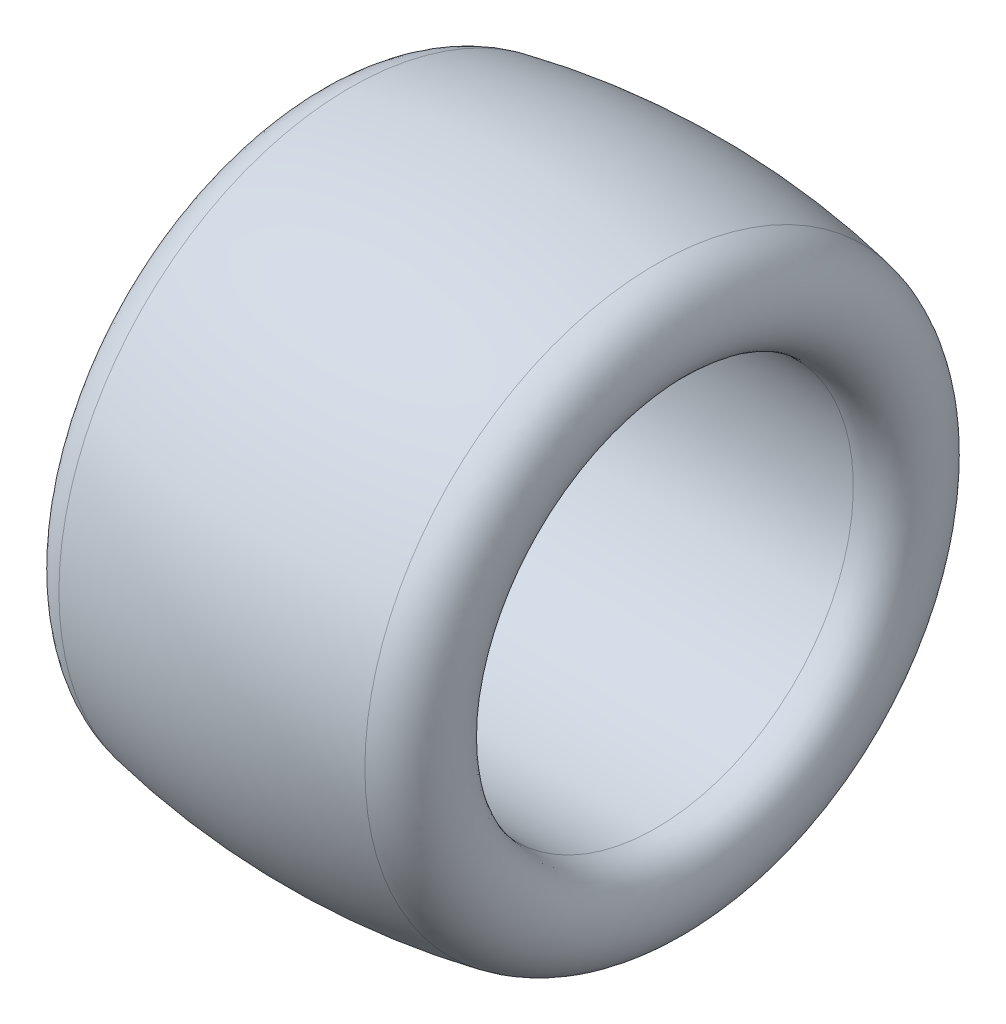
from build123d import *

# Parameters (mm, degrees)
SCALE1_SCALE = 2


with BuildPart() as part:
    # Sketch1 → Revolve1 (revolve)
    with BuildSketch(Plane.XY):
        with BuildLine():
            Line((-19.685, 25.4), (19.685, 25.4))
            add(Edge.make_bspline(
                [(19.685, 25.4), (26.82317767, 25.4), (26.618738623, 36.110298966), (19.685, 37.465)],
                knots=[0, 0, 0, 0, 1, 1, 1, 1], degree=3))
            ThreePointArc((19.685, 37.465), (0, 39.37), (-19.685, 37.465))
            add(Edge.make_bspline(
                [(-19.685, 25.4), (-26.82317767, 25.4), (-26.618738623, 36.110298966), (-19.685, 37.465)],
                knots=[0, 0, 0, 0, 1, 1, 1, 1], degree=3))
        make_face()
    revolve(axis=Axis((-19.685, 0, 0), (1, 0, 0)))


with BuildPart() as part_1:
    # Scale1: scaled about (0, 0, 0)
    add(part.part.scale(SCALE1_SCALE))


solid = part_1.part
